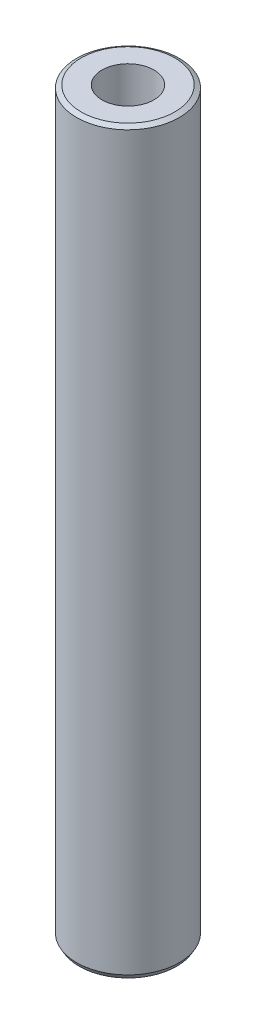
from build123d import *
from OCP.BRepFilletAPI import BRepFilletAPI_MakeChamfer

# Parameters (mm, degrees)
SKETCH1_R           = 32.5
BOSS_EXTRUDE1_DEPTH = 467.771583087
SKETCH2_R           = 16.434023041
CUT_EXTRUDE1_DEPTH  = 471.0242057
CHAMFER1_SIZE       = 1.647747588
CHAMFER1_SIZE2      = 2.85398254


with BuildPart() as part:
    # Sketch1 → Boss-Extrude1 (new body)
    with BuildSketch(Plane(origin=(0, 0, 0), x_dir=(1, 0, 0), z_dir=(0, 1, 0))):
        Circle(SKETCH1_R)
    extrude(amount=BOSS_EXTRUDE1_DEPTH)

    # Sketch2 → Cut-Extrude1 (cut, through all)
    with BuildSketch(Plane(origin=(0, 0, 0), x_dir=(1, 0, 0), z_dir=(0, 1, 0))):
        Circle(SKETCH2_R)
    extrude(amount=CUT_EXTRUDE1_DEPTH, mode=Mode.SUBTRACT)

    # Chamfer1: one chamfer whose edges measure the first distance from different faces: ONE call of the kernel's chamfer builder (chamfer() names one face for all edges)
    chamfer1_edges_1 = [part.edges().sort_by_distance(p)[0] for p in [
        (-32.5, 467.771583087, 0),
    ]]
    chamfer1_side_1 = [part.faces().sort_by_distance(p)[0] for p in [
        (-32.5, 233.885791544, 0),
    ]]
    chamfer1_edges_2 = [part.edges().sort_by_distance(p)[0] for p in [
        (-32.5, 0, 0),
    ]]
    chamfer1_side_2 = [part.faces().sort_by_distance(p)[0] for p in [
        (-31.580761184, 0, 0),
    ]]
    chamfer1 = BRepFilletAPI_MakeChamfer(part.part.solid().wrapped)
    for e in chamfer1_edges_1:
        chamfer1.Add(CHAMFER1_SIZE, CHAMFER1_SIZE2, e.wrapped, chamfer1_side_1[0].wrapped)  # the first distance lies on this face
    for e in chamfer1_edges_2:
        chamfer1.Add(CHAMFER1_SIZE, CHAMFER1_SIZE2, e.wrapped, chamfer1_side_2[0].wrapped)  # the first distance lies on this face
    add(Compound.cast(chamfer1.Shape()), mode=Mode.REPLACE)


solid = part.part
